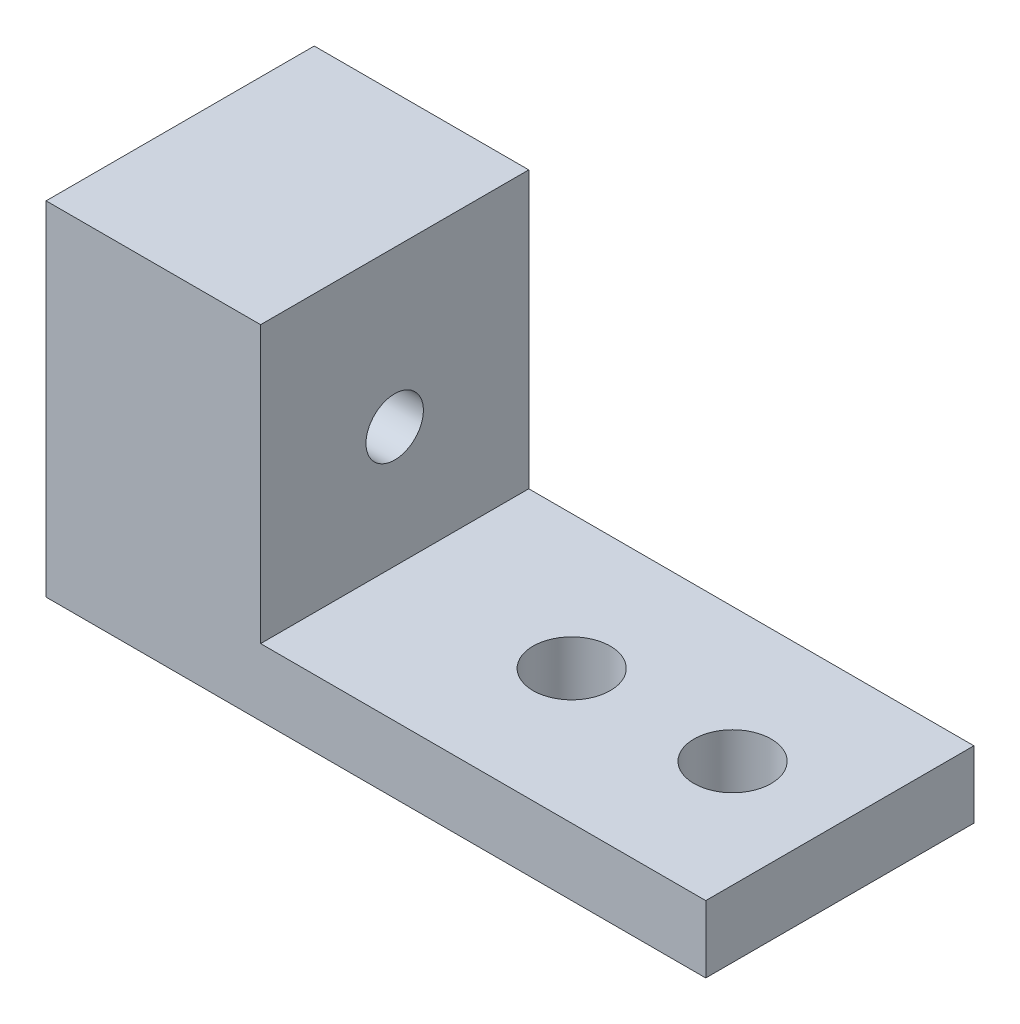
from build123d import *

# Parameters (mm, degrees)
BOSS_EXTRUDE1_DEPTH = 6.35
CUT_EXTRUDE1_REACH  = 37.786
SKETCH2_R           = 1.3589
CUT_EXTRUDE2_REACH  = 37.786
SKETCH3_R           = 1.8288
LPATTERN1_COUNT     = 2
LPATTERN1_PITCH     = 7.62


with BuildPart() as part:
    # Sketch1 → Boss-Extrude1 (new, symmetric)
    with BuildSketch(Plane.XY):
        Polygon((0, 0), (0, 16.256), (10.16, 16.256), (10.16, 3.175), (31.242, 3.175), (31.242, 0), align=None)
    extrude(amount=BOSS_EXTRUDE1_DEPTH, both=True)

    # Sketch2 → Cut-Extrude1 (cut, up to next)
    with BuildSketch(Plane.ZY, mode=Mode.PRIVATE) as cut_extrude1_sk1:
        with Locations((0, 8.89)):
            Circle(SKETCH2_R)
    cut_extrude1_tool1 = extrude(cut_extrude1_sk1.sketch, amount=-CUT_EXTRUDE1_REACH, mode=Mode.PRIVATE) & part.part
    add(cut_extrude1_tool1.solids().sort_by_distance((0, 8.89, 0))[0], mode=Mode.SUBTRACT)

    # Sketch3 → Cut-Extrude2 (cut, up to next)
    with BuildSketch(Plane.XZ, mode=Mode.PRIVATE) as cut_extrude2_sk1:
        with Locations((18.542, 0)):
            Circle(SKETCH3_R)
    cut_extrude2_tool1 = extrude(cut_extrude2_sk1.sketch, amount=-CUT_EXTRUDE2_REACH, mode=Mode.PRIVATE) & part.part
    cut_extrude2 = cut_extrude2_tool1.solids().sort_by_distance((18.542, 0, 0))[0]
    add(cut_extrude2, mode=Mode.SUBTRACT)

    # LPattern1: Cut-Extrude2 ×2
    with Locations(*[(i * LPATTERN1_PITCH, 0, 0) for i in range(1, LPATTERN1_COUNT)]):
        add(cut_extrude2, mode=Mode.SUBTRACT)


solid = part.part
